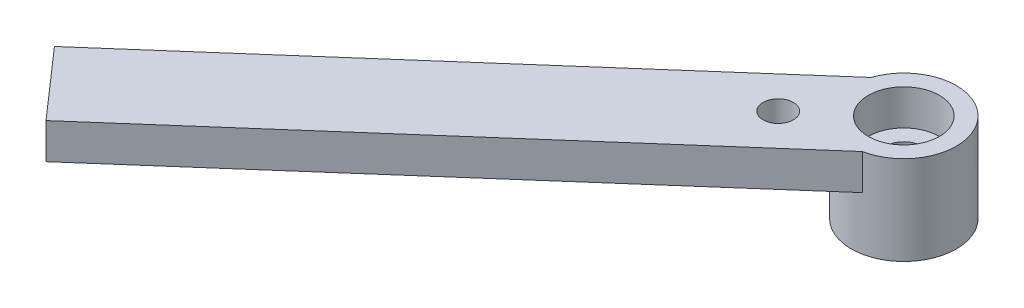
from build123d import *

# Parameters (mm, degrees)
EXTRUDE_START       = -4
EXTRUDE_1_OUTLINE_R = 4
EXTRUDE_1_DEPTH     = 4
EXTRUDE_START_2     = 6
SKETCH_2_R          = 5.9
SKETCH_2_R_2        = 2.1
EXTRUDE_2_DEPTH     = 6
SKETCH_3_R          = 1.7
CUT_EXTRUDE_1_DEPTH = 4


# Read off the part's stored shape, not the designer's step: 填料-伸長1
with BuildPart() as part:
    # 填料-伸長1 outline → 填料-伸長1 (new body)
    with BuildSketch(Plane(origin=(0, 20.156954032, 0), x_dir=(1, 0, 0), z_dir=(0, 1, 0)).offset(EXTRUDE_START)):
        with BuildLine():
            Line((-102.099122719, -450.012320429), (-53.224889363, -407.160140626))
            ThreePointArc((-53.224889363, -407.160140626), (-49.935495794, -397.483024153), (-59.959608209, -399.47898597))
            Line((-59.959608209, -399.47898597), (-108.833841565, -442.331165772))
            Line((-108.833841565, -442.331165772), (-102.099122719, -450.012320429))
        make_face()
        with Locations((-54.371772361, -401.372683552)):
            Circle(EXTRUDE_1_OUTLINE_R, mode=Mode.SUBTRACT)
    extrude(amount=EXTRUDE_1_DEPTH)

    # 草圖2 → 填料-伸長2 (add)
    with BuildSketch(Plane.XZ.offset(-16.156954032).offset(EXTRUDE_START_2)):
        with Locations(Location((-54.371772361, 401.372683552, 0), (0, 0, 198.721335886))):
            Circle(SKETCH_2_R)
        with Locations((-54.371772361, 401.372683552)):
            Circle(SKETCH_2_R_2, mode=Mode.SUBTRACT)
    extrude(amount=-EXTRUDE_2_DEPTH)

    # 草圖3 → 除料-伸長1 (cut)
    with BuildSketch(Plane.XZ.offset(-16.156954032)):
        with Locations((-61.890885185, 407.965326598)):
            Circle(SKETCH_3_R)
    extrude(amount=-CUT_EXTRUDE_1_DEPTH, mode=Mode.SUBTRACT)


solid = part.part
